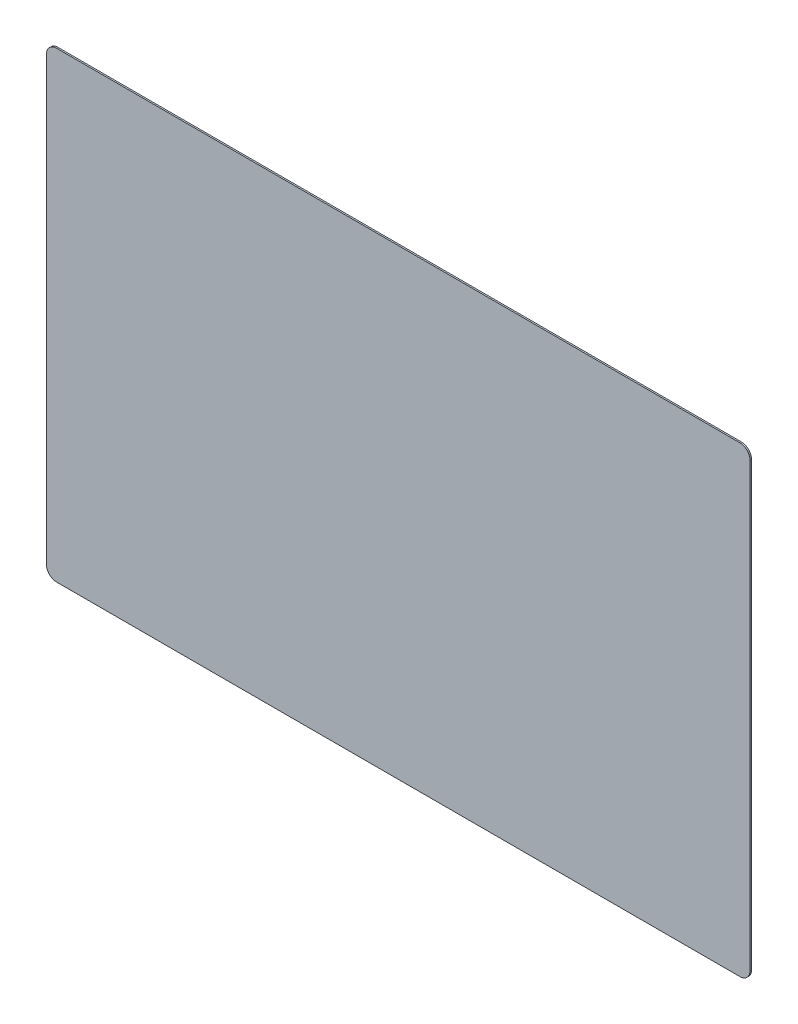
from build123d import *

# Parameters (mm, degrees)
SKETCH1_W          = 700
SKETCH1_H          = 460
BASE_FLANGE1_DEPTH = 1.5
FILLET1_R          = 10


# Sheet-metal steps are written as plain solids
with BuildPart() as part:
    # Sketch1 → Base-Flange1 (new body)
    with BuildSketch(Plane.XY):
        Rectangle(SKETCH1_W, SKETCH1_H)
    extrude(amount=-BASE_FLANGE1_DEPTH)

    # Fillet1
    fillet1_edges = [part.edges().sort_by_distance(p)[0] for p in [
        (-350, 230, -0.75),
        (350, 230, -0.75),
        (350, -230, -0.75),
        (-350, -230, -0.75),
    ]]
    fillet(fillet1_edges, radius=FILLET1_R)


solid = part.part
